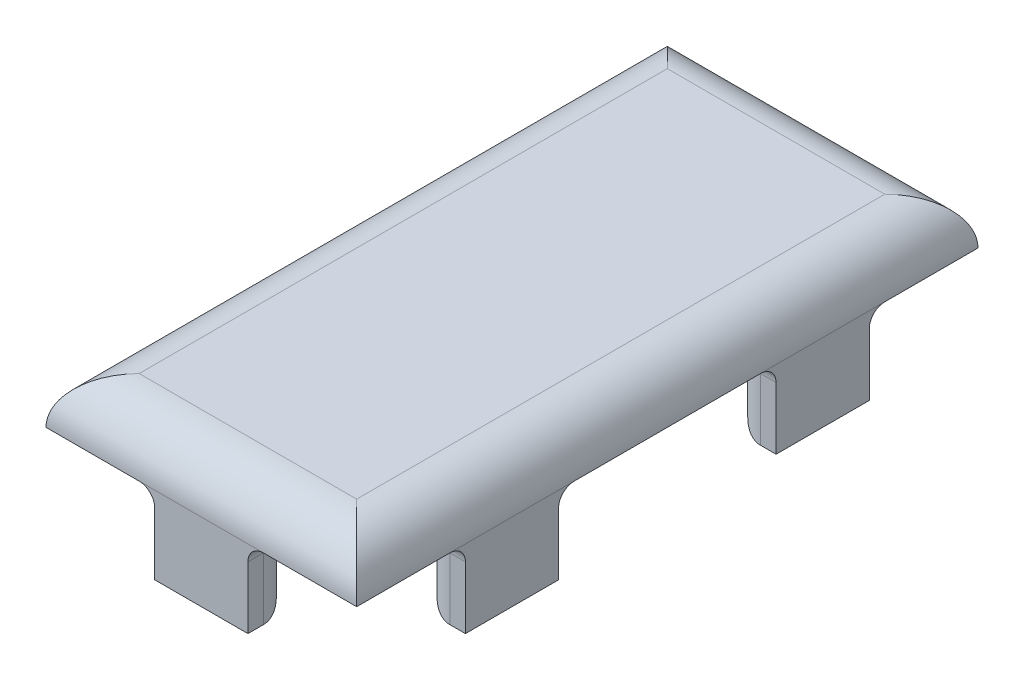
from build123d import *

# Parameters (mm, degrees)
ESBO_O1_W                = 20
ESBO_O1_H                = 40
RESSALTO_EXTRUS_O1_DEPTH = 3
FILETE1_R                = 3
ESBO_O2_W                = 6
ESBO_O2_H                = 3
ESBO_O2_W_2              = 3
ESBO_O2_H_2              = 6
RESSALTO_EXTRUS_O2_DEPTH = 5
FILETE2_R                = 2
FILETE3_R                = 1


with BuildPart() as part:
    # Esboço1 → Ressalto-extrusão1 (new body)
    with BuildSketch(Plane(origin=(0, 0, 0), x_dir=(1, 0, 0), z_dir=(0, 1, 0))):
        with Locations((10, 20)):
            Rectangle(ESBO_O1_W, ESBO_O1_H)
    extrude(amount=RESSALTO_EXTRUS_O1_DEPTH)

    # Filete1
    filete1_edges = [part.edges().sort_by_distance(p)[0] for p in [
        (10, 3, -40),
        (20, 3, -20),
        (10, 3, 0),
        (0, 3, -20),
    ]]
    fillet(filete1_edges, radius=FILETE1_R - 0.0001)  # a hair under: the kernel refuses the full size

    # Esboço2 → Ressalto-extrusão2 (add)
    with BuildSketch(Plane.XZ):
        with Locations((10, -1.5)):
            Rectangle(ESBO_O2_W, ESBO_O2_H)
        with Locations((10, -38.5)):
            Rectangle(ESBO_O2_W, ESBO_O2_H)
        with Locations((1.5, -30)):
            Rectangle(ESBO_O2_W_2, ESBO_O2_H_2)
        with Locations((18.5, -10)):
            Rectangle(ESBO_O2_W_2, ESBO_O2_H_2)
        with Locations((18.5, -30)):
            Rectangle(ESBO_O2_W_2, ESBO_O2_H_2)
        with Locations((1.5, -10)):
            Rectangle(ESBO_O2_W_2, ESBO_O2_H_2)
    extrude(amount=RESSALTO_EXTRUS_O2_DEPTH)

    # Filete2
    filete2_edges = [part.edges().sort_by_distance(p)[0] for p in [
        (13, -2.5, -3),
        (7, -2.5, -3),
        (10, -5, -3),
        (7, -2.5, -37),
        (13, -2.5, -37),
        (10, -5, -37),
        (17, -2.5, -7),
        (17, -2.5, -13),
        (17, -5, -10),
        (17, -2.5, -27),
        (17, -2.5, -33),
        (17, -5, -30),
        (3, -2.5, -33),
        (3, -2.5, -27),
        (3, -5, -30),
        (3, -2.5, -13),
        (3, -2.5, -7),
        (3, -5, -10),
    ]]
    fillet(filete2_edges, radius=FILETE2_R)

    # Filete3
    filete3_edges = [part.edges().sort_by_distance(p)[0] for p in [
        (3, 0, -30),
        (0.5, 0, -27),
        (19.5, 0, -33),
        (17, 0, -30),
        (19.5, 0, -13),
        (17, 0, -10),
        (10, 0, -3),
        (13, 0, -0.5),
        (3, 0, -10),
        (0.5, 0, -7),
        (7.585786438, 0, -37.585786438),
        (12.414213562, 0, -37.585786438),
        (2.414213562, 0, -32.414213562),
        (2.414213562, 0, -27.585786438),
        (17.585786438, 0, -32.414213562),
        (17.585786438, 0, -27.585786438),
        (17.585786438, 0, -12.414213562),
        (17.585786438, 0, -7.585786438),
        (7.585786438, 0, -2.414213562),
        (12.414213562, 0, -2.414213562),
        (2.414213562, 0, -12.414213562),
        (2.414213562, 0, -7.585786438),
        (7, 0, -0.5),
        (13, 0, -39.5),
        (19.5, 0, -7),
        (19.5, 0, -27),
        (0.5, 0, -33),
        (0.5, 0, -13),
        (7, 0, -39.5),
        (10, 0, -37),
    ]]
    fillet(filete3_edges, radius=FILETE3_R)


solid = part.part
